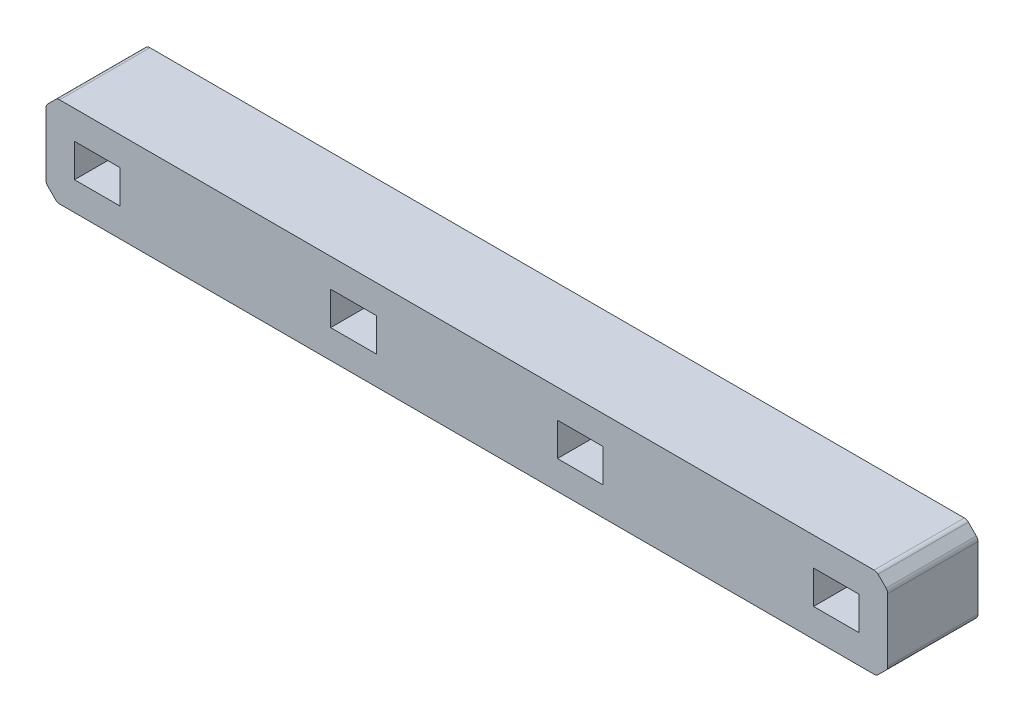
from build123d import *

# Parameters (mm, degrees)
SKETCH2_W           = 373
SKETCH2_H           = 40
BOSS_EXTRUDE1_DEPTH = 40
SKETCH3_W           = 20.25
SKETCH3_H           = 14.75
CUT_EXTRUDE1_DEPTH  = 192.786991217
CHAMFER1_SIZE       = 5
FILLET1_R           = 2.5


with BuildPart() as part:
    # Sketch2 → Boss-Extrude1 (new body)
    with BuildSketch(Plane.XY):
        Rectangle(SKETCH2_W, SKETCH2_H)
    extrude(amount=BOSS_EXTRUDE1_DEPTH)

    # Sketch3 → Cut-Extrude1 (cut, through all)
    with BuildSketch(Plane.XY.offset(40)):
        with Locations((-163.75, 0)):
            Rectangle(SKETCH3_W, SKETCH3_H)
        with Locations((-50.25, 0)):
            Rectangle(SKETCH3_W, SKETCH3_H)
        with Locations((50.25, 0)):
            Rectangle(SKETCH3_W, SKETCH3_H)
        with Locations((163.75, 0)):
            Rectangle(SKETCH3_W, SKETCH3_H)
    extrude(amount=-CUT_EXTRUDE1_DEPTH, mode=Mode.SUBTRACT)

    # Chamfer1
    chamfer1_edges = [part.edges().sort_by_distance(p)[0] for p in [
        (186.5, 20, 20),
        (186.5, -20, 20),
        (-186.5, -20, 20),
        (-186.5, 20, 20),
    ]]
    chamfer(chamfer1_edges, length=CHAMFER1_SIZE)

    # Fillet1
    fillet1_edges = [part.edges().sort_by_distance(p)[0] for p in [
        (181.5, 20, 20),
        (186.5, 15, 20),
        (186.5, -15, 20),
        (181.5, -20, 20),
        (-181.5, -20, 20),
        (-186.5, -15, 20),
        (-181.5, 20, 20),
        (-186.5, 15, 20),
    ]]
    fillet(fillet1_edges, radius=FILLET1_R)


solid = part.part
